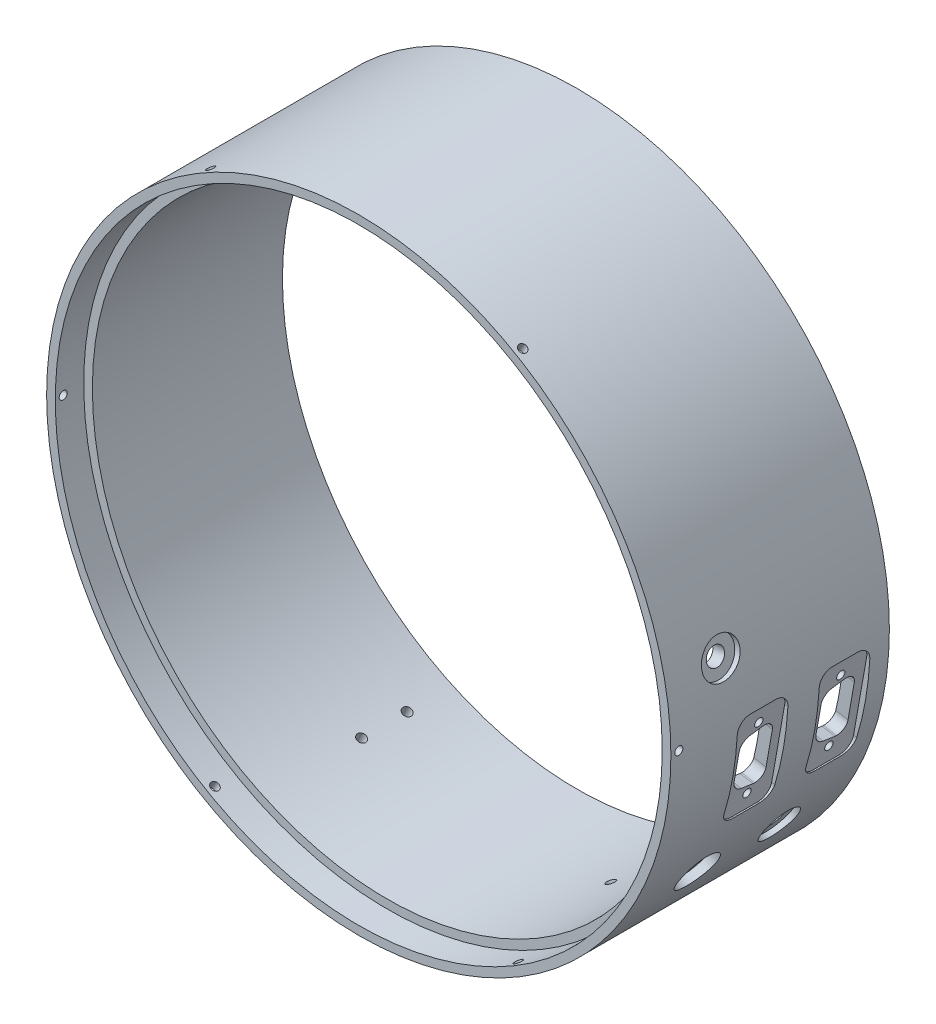
from build123d import *

# Parameters (mm, degrees)
SKETCH1_R                     = 114.3
SKETCH1_R_2                   = 107.95
BOSS_EXTRUDE1_DEPTH           = 80
CUT_EXTRUDE1_START            = -10.39855
SKETCH2_R                     = 111.125
SKETCH2_R_2                   = 107.95
CUT_EXTRUDE1_DEPTH            = 10.39855
TAP_DRILL_FOR_4_40_TAP1_D     = 2.2606
TAP_DRILL_FOR_4_40_TAP1_DEPTH = 8.89
TAP_DRILL_FOR_4_40_TAP1_TIP   = 0.679152758
SKETCH5_R                     = 1.473
CUT_EXTRUDE2_DEPTH            = 5
CIRPATTERN1_COUNT             = 6
SKETCH8_R                     = 1.63195
CUT_EXTRUDE4_DEPTH            = 10
SKETCH9_R                     = 1.63195
CUT_EXTRUDE5_DEPTH            = 10
CUT_EXTRUDE7_DEPTH            = 2
SKETCH13_3_R                  = 1.524
CUT_EXTRUDE8_DEPTH            = 20
SKETCH14_R                    = 6.985
CUT_EXTRUDE9_DEPTH            = 2
SKETCH14_3_R                  = 3.302
CUT_EXTRUDE10_DEPTH           = 20
SKETCH17_R                    = 6.985
CUT_EXTRUDE11_DEPTH           = 2
SKETCH17_3_R                  = 3.302
CUT_EXTRUDE12_DEPTH           = 20
CUT_EXTRUDE13_START           = -18
CUT_EXTRUDE13_DEPTH           = 18
SKETCH18_R                    = 4.699
CUT_EXTRUDE14_DEPTH           = 10
SKETCH18_3_R                  = 7.62
SKETCH18_3_R_2                = 4.699
CUT_EXTRUDE15_DEPTH           = 3.175


with BuildPart() as part:
    # Sketch1 → Boss-Extrude1 (new body)
    with BuildSketch(Plane.XY):
        Circle(SKETCH1_R)
        Circle(SKETCH1_R_2, mode=Mode.SUBTRACT)
    extrude(amount=BOSS_EXTRUDE1_DEPTH)

    # Sketch2 → Cut-Extrude1 (cut)
    with BuildSketch(Plane.XY.offset(80).offset(CUT_EXTRUDE1_START)):
        Circle(SKETCH2_R)
        Circle(SKETCH2_R_2, mode=Mode.SUBTRACT)
    extrude(amount=CUT_EXTRUDE1_DEPTH, mode=Mode.SUBTRACT)

    # Tap Drill for #4-40 Tap1
    with Locations(Plane(origin=(0, -111.125, 0), x_dir=(-1, 0, 0), z_dir=(0, 0, -1))):
        with Locations((0, 0), (-96.237072996, 55.5625), (96.237072996, 55.5625), (96.237072996, 166.6875), (0, 222.25), (-96.237072996, 166.6875)):
            Hole(TAP_DRILL_FOR_4_40_TAP1_D / 2, depth=TAP_DRILL_FOR_4_40_TAP1_DEPTH)
            with Locations((0, 0, -(TAP_DRILL_FOR_4_40_TAP1_DEPTH + TAP_DRILL_FOR_4_40_TAP1_TIP / 2))):  # 118° drill point
                Cone(0, TAP_DRILL_FOR_4_40_TAP1_D / 2, TAP_DRILL_FOR_4_40_TAP1_TIP, mode=Mode.SUBTRACT)

    # Sketch5 → Cut-Extrude2 (cut)
    with BuildSketch(Plane(origin=(114.3, 0, 0), x_dir=(0, 0, -1), z_dir=(1, 0, 0))):
        with Locations((-77.10145, 0)):
            Circle(SKETCH5_R)
    cut_extrude2 = extrude(amount=-CUT_EXTRUDE2_DEPTH, mode=Mode.SUBTRACT)

    # CirPattern1: Cut-Extrude2 ×6 about axis
    cirpattern1_axis = Axis((0, 0, 80), (0, 0, -1))
    for i in range(1, CIRPATTERN1_COUNT):
        add(cut_extrude2.rotate(cirpattern1_axis, i * 360 / CIRPATTERN1_COUNT), mode=Mode.SUBTRACT)

    # Sketch8 → Cut-Extrude4 (cut)
    with BuildSketch(Plane(origin=(-48.305267317, -103.590980058, 0), x_dir=(0.9063077870366497, -0.4226182617407001, 0), z_dir=(-0.4226182617407001, -0.9063077870366497, 0))):
        with Locations((0, 16.666666667)):
            Circle(SKETCH8_R)
        with Locations((0, 33.333333333)):
            Circle(SKETCH8_R)
    extrude(amount=-CUT_EXTRUDE4_DEPTH, mode=Mode.SUBTRACT)

    # Sketch9 → Cut-Extrude5 (cut)
    with BuildSketch(Plane(origin=(48.305267317, -103.590980058, 0), x_dir=(0.9063077870366496, 0.42261826174070016, 0), z_dir=(0.4226182617407002, -0.9063077870366497, 0))):
        with Locations((0, 33.333333333)):
            Circle(SKETCH9_R)
        with Locations((0, 16.666666667)):
            Circle(SKETCH9_R)
    extrude(amount=-CUT_EXTRUDE5_DEPTH, mode=Mode.SUBTRACT)

    # Sketch13 → Cut-Extrude7 (cut)
    with BuildSketch(Plane(origin=(112.563526169, -19.847986707, 0), x_dir=(0, 0, -1), z_dir=(0.9848077530122087, -0.17364817766692703, 0))):
        with BuildLine():
            ThreePointArc((-21.0236, 18.367), (-24.222551078, 17.041951078), (-25.5476, 13.843))
            Line((-25.5476, 13.843), (-25.5476, -13.843))
            ThreePointArc((-25.5476, -13.843), (-24.222551078, -17.041951078), (-21.0236, -18.367))
            Line((-21.0236, -18.367), (-11.524, -18.367))
            ThreePointArc((-11.524, -18.367), (-8.325048922, -17.041951078), (-7, -13.843))
            Line((-7, -13.843), (-7, 13.843))
            ThreePointArc((-7, 13.843), (-8.325048922, 17.041951078), (-11.524, 18.367))
            Line((-11.524, 18.367), (-21.0236, 18.367))
        make_face()
        with BuildLine():
            ThreePointArc((-51.0236, 18.367), (-54.222551078, 17.041951078), (-55.5476, 13.843))
            Line((-55.5476, 13.843), (-55.5476, -13.843))
            ThreePointArc((-55.5476, -13.843), (-54.222551078, -17.041951078), (-51.0236, -18.367))
            Line((-51.0236, -18.367), (-41.524, -18.367))
            ThreePointArc((-41.524, -18.367), (-38.325048922, -17.041951078), (-37, -13.843))
            Line((-37, -13.843), (-37, 13.843))
            ThreePointArc((-37, 13.843), (-38.325048922, 17.041951078), (-41.524, 18.367))
            Line((-41.524, 18.367), (-51.0236, 18.367))
        make_face()
    extrude(amount=-CUT_EXTRUDE7_DEPTH, mode=Mode.SUBTRACT)

    # Sketch13<3> → Cut-Extrude8 (cut)
    with BuildSketch(Plane(origin=(112.563526169, -19.847986707, 0), x_dir=(0, 0, -1), z_dir=(0.9848077530122087, -0.17364817766692703, 0))):
        with BuildLine():
            Line((-18.897206194, -9.347716366), (-14.46559292, -10.129129354))
            ThreePointArc((-14.46559292, -10.129129354), (-14.158014553, -10.169492531), (-13.8481, -10.183152984))
            add(Edge.make_bspline(
                [(-10.2921, -6.627152984), (-10.292302399, -7.305680938), (-10.541772801, -7.936097772), (-10.812570474, -8.620409057), (-11.333628286, -9.141624698), (-11.85394102, -9.662095036), (-12.539155213, -9.933480183), (-13.169036961, -10.182950425), (-13.8481, -10.183152984)],
                knots=[0, 0, 0, 0.25, 0.25, 0.5, 0.5, 0.75, 0.75, 1, 1, 1], degree=2))
            Line((-10.2921, -6.627152984), (-10.2921, 6.627152984))
            add(Edge.make_bspline(
                [(-14.46559292, 10.129129354), (-14.086425799, 10.19586718), (-13.702323219, 10.180163698), (-13.308998523, 10.164083183), (-12.927739476, 10.061985223), (-12.547484558, 9.96015616), (-12.197841039, 9.777038913), (-11.85750298, 9.598795173), (-11.56234726, 9.351207024), (-11.268003732, 9.104300174), (-11.032632378, 8.799312755), (-10.792126526, 8.487672202), (-10.625269509, 8.129983523), (-10.458851947, 7.773236897), (-10.374381375, 7.387688925), (-10.292217911, 7.012671256), (-10.2921, 6.627152984)],
                knots=[0, 0, 0, 0.125, 0.125, 0.25, 0.25, 0.375, 0.375, 0.5, 0.5, 0.625, 0.625, 0.75, 0.75, 0.875, 0.875, 1, 1, 1], degree=2))
            Line((-14.46559292, 10.129129354), (-18.897206194, 9.347716366))
            add(Edge.make_bspline(
                [(-22.2555, 5.345457658), (-22.255316875, 6.039361953), (-22.025421043, 6.693473026), (-21.780358727, 7.39073654), (-21.304704617, 7.957746503), (-20.829708488, 8.523972112), (-20.184789389, 8.887052413), (-19.581047307, 9.226950638), (-18.897206194, 9.347716366)],
                knots=[0, 0, 0, 0.25, 0.25, 0.5, 0.5, 0.75, 0.75, 1, 1, 1], degree=2))
            Line((-22.2555, 5.345457658), (-22.2555, -5.345457658))
            add(Edge.make_bspline(
                [(-18.897206194, -9.347716366), (-19.580536724, -9.227040806), (-20.184789389, -8.887052413), (-20.828905278, -8.524634605), (-21.304704617, -7.957746503), (-21.779845774, -7.391642587), (-22.025421043, -6.693473026), (-22.255316738, -6.039880436), (-22.2555, -5.345457658)],
                knots=[0, 0, 0, 0.25, 0.25, 0.5, 0.5, 0.75, 0.75, 1, 1, 1], degree=2))
        make_face()
        with Locations((-16.2738, 12.4968)):
            Circle(SKETCH13_3_R)
        with Locations((-16.2738, -12.4968)):
            Circle(SKETCH13_3_R)
        with BuildLine():
            Line((-48.897206194, -9.347716366), (-44.46559292, -10.129129354))
            ThreePointArc((-44.46559292, -10.129129354), (-44.158014553, -10.169492531), (-43.8481, -10.183152984))
            add(Edge.make_bspline(
                [(-40.2921, -6.627152984), (-40.292302399, -7.305680938), (-40.541772801, -7.936097772), (-40.812570474, -8.620409057), (-41.333628286, -9.141624698), (-41.85394102, -9.662095036), (-42.539155213, -9.933480183), (-43.169036961, -10.182950425), (-43.8481, -10.183152984)],
                knots=[0, 0, 0, 0.25, 0.25, 0.5, 0.5, 0.75, 0.75, 1, 1, 1], degree=2))
            Line((-40.2921, -6.627152984), (-40.2921, 6.627152984))
            add(Edge.make_bspline(
                [(-44.46559292, 10.129129354), (-44.086425799, 10.19586718), (-43.702323219, 10.180163698), (-43.308998523, 10.164083183), (-42.927739476, 10.061985223), (-42.547484558, 9.96015616), (-42.197841039, 9.777038913), (-41.85750298, 9.598795173), (-41.56234726, 9.351207024), (-41.268003732, 9.104300174), (-41.032632378, 8.799312755), (-40.792126526, 8.487672202), (-40.625269509, 8.129983523), (-40.458851947, 7.773236897), (-40.374381375, 7.387688925), (-40.292217911, 7.012671256), (-40.2921, 6.627152984)],
                knots=[0, 0, 0, 0.125, 0.125, 0.25, 0.25, 0.375, 0.375, 0.5, 0.5, 0.625, 0.625, 0.75, 0.75, 0.875, 0.875, 1, 1, 1], degree=2))
            Line((-44.46559292, 10.129129354), (-48.897206194, 9.347716366))
            add(Edge.make_bspline(
                [(-52.2555, 5.345457658), (-52.255316875, 6.039361953), (-52.025421043, 6.693473026), (-51.780358727, 7.39073654), (-51.304704617, 7.957746503), (-50.829708488, 8.523972112), (-50.184789389, 8.887052413), (-49.581047307, 9.226950638), (-48.897206194, 9.347716366)],
                knots=[0, 0, 0, 0.25, 0.25, 0.5, 0.5, 0.75, 0.75, 1, 1, 1], degree=2))
            Line((-52.2555, 5.345457658), (-52.2555, -5.345457658))
            add(Edge.make_bspline(
                [(-48.897206194, -9.347716366), (-49.580536724, -9.227040806), (-50.184789389, -8.887052413), (-50.828905278, -8.524634605), (-51.304704617, -7.957746503), (-51.779845774, -7.391642587), (-52.025421043, -6.693473026), (-52.255316738, -6.039880436), (-52.2555, -5.345457658)],
                knots=[0, 0, 0, 0.25, 0.25, 0.5, 0.5, 0.75, 0.75, 1, 1, 1], degree=2))
        make_face()
        with Locations((-46.2738, 12.4968)):
            Circle(SKETCH13_3_R)
        with Locations((-46.2738, -12.4968)):
            Circle(SKETCH13_3_R)
    extrude(amount=-CUT_EXTRUDE8_DEPTH, mode=Mode.SUBTRACT)

    # Sketch14 → Cut-Extrude9 (cut)
    with BuildSketch(Plane(origin=(98.986703653, -57.15, 0), x_dir=(0.4999999999999979, 0.8660254037844399, 0), z_dir=(0.8660254037844399, -0.4999999999999979, 0))):
        with Locations((0, 25)):
            Circle(SKETCH14_R)
    extrude(amount=-CUT_EXTRUDE9_DEPTH, mode=Mode.SUBTRACT)

    # Sketch14<3> → Cut-Extrude10 (cut)
    with BuildSketch(Plane(origin=(98.986703653, -57.15, 0), x_dir=(0.4999999999999979, 0.8660254037844399, 0), z_dir=(0.8660254037844399, -0.4999999999999979, 0))):
        with Locations((0, 25)):
            Circle(SKETCH14_3_R)
    extrude(amount=-CUT_EXTRUDE10_DEPTH, mode=Mode.SUBTRACT)

    # Sketch17 → Cut-Extrude11 (cut)
    with BuildSketch(Plane(origin=(112.563526169, 19.847986707, 0), x_dir=(0, 0, -1), z_dir=(0.984807753012208, 0.17364817766693083, 0))):
        with Locations((-60, 0)):
            Circle(SKETCH17_R)
    extrude(amount=-CUT_EXTRUDE11_DEPTH, mode=Mode.SUBTRACT)

    # Sketch17<3> → Cut-Extrude12 (cut)
    with BuildSketch(Plane(origin=(112.563526169, 19.847986707, 0), x_dir=(0, 0, -1), z_dir=(0.984807753012208, 0.17364817766693083, 0))):
        with Locations((-60, 0)):
            Circle(SKETCH17_3_R)
    extrude(amount=-CUT_EXTRUDE12_DEPTH, mode=Mode.SUBTRACT)

    # Sketch15 → Cut-Extrude13 (cut)
    with BuildSketch(Plane.XY.offset(80).offset(CUT_EXTRUDE13_START)):
        with BuildLine():
            Line((109.083320761, 21.203649611), (0, 0))
            Line((0, 0), (109.756866849, 17.383779928))
            ThreePointArc((109.756866849, 17.383779928), (109.436761553, 19.296653743), (109.083320761, 21.203649611))
        make_face()
    extrude(amount=CUT_EXTRUDE13_DEPTH, mode=Mode.SUBTRACT)

    # Sketch18 → Cut-Extrude14 (cut)
    with BuildSketch(Plane(origin=(98.986703653, -57.15, 0), x_dir=(0.4999999999999979, 0.8660254037844399, 0), z_dir=(0.8660254037844399, -0.4999999999999979, 0))):
        with Locations((0, 55)):
            Circle(SKETCH18_R)
    extrude(amount=-CUT_EXTRUDE14_DEPTH, mode=Mode.SUBTRACT)

    # Sketch18<3> → Cut-Extrude15 (cut)
    with BuildSketch(Plane(origin=(98.986703653, -57.15, 0), x_dir=(0.4999999999999979, 0.8660254037844399, 0), z_dir=(0.8660254037844399, -0.4999999999999979, 0))):
        with Locations((0, 55)):
            Circle(SKETCH18_3_R)
        with Locations((0, 55)):
            Circle(SKETCH18_3_R_2, mode=Mode.SUBTRACT)
    extrude(amount=-CUT_EXTRUDE15_DEPTH, mode=Mode.SUBTRACT)


solid = part.part
